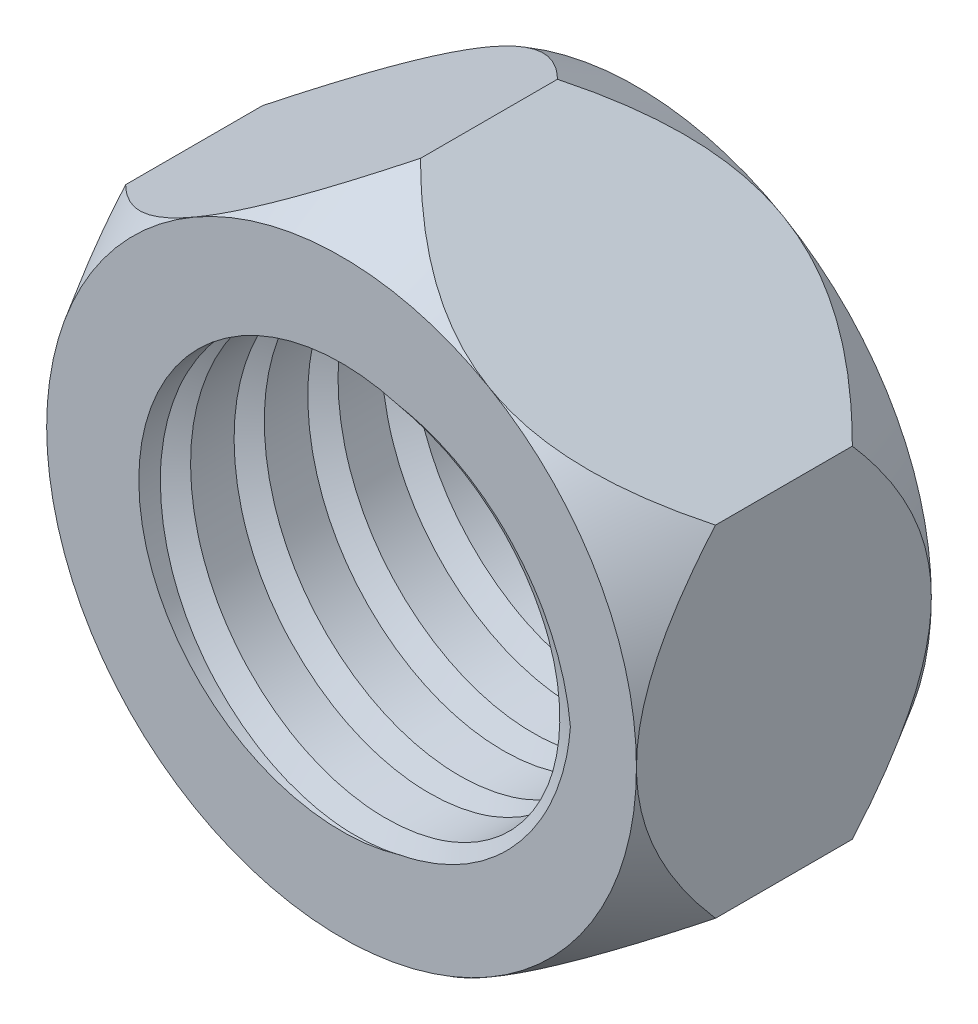
from build123d import *

# Parameters (mm, degrees)
Y_KSEKLIK_EKSTR_ZYON1_DEPTH = 4
IZIM2_OUTSIDE_W             = 17.19
IZIM2_OUTSIDE_H             = 18.428
IZIM2_OUTSIDE_R             = 4
KES_EKSTR_ZYON1_DEPTH       = 4
KES_EKSTR_ZYON1_DRAFT       = -30
IZIM3_OUTSIDE_W             = 17.19
IZIM3_OUTSIDE_H             = 18.428
IZIM3_OUTSIDE_R             = 4
KES_EKSTR_ZYON2_DEPTH       = 4
KES_EKSTR_ZYON2_DRAFT       = -30
KES_EKSTR_ZYON3_REACH       = 9.303
IZIM4_R                     = 2.75
KES_S_P_R2_PITCH            = 1


with BuildPart() as part:
    # Çizim1 → Yükseklik-Ekstrüzyon1 (new body)
    with BuildSketch(Plane.XY):
        Polygon((0, 4.618802154), (-4, 2.309401077), (-4, -2.309401077), (0, -4.618802154), (4, -2.309401077), (4, 2.309401077), align=None)
    extrude(amount=Y_KSEKLIK_EKSTR_ZYON1_DEPTH)


with BuildPart() as kes_ekstr_zyon1_tool:
    # Çizim2 outside → Kes-Ekstrüzyon1 (with draft: the straight prism first)
    with BuildSketch(Plane.XY.offset(4)):
        Rectangle(IZIM2_OUTSIDE_W, IZIM2_OUTSIDE_H)
        Circle(IZIM2_OUTSIDE_R, mode=Mode.SUBTRACT)
    extrude(amount=-KES_EKSTR_ZYON1_DEPTH)
    # Kes-Ekstrüzyon1: the draft: its side faces are tilted about the plane it starts from
    kes_ekstr_zyon1_sides = [kes_ekstr_zyon1_tool.faces().sort_by_distance(p)[0] for p in [
        (0, -9.214, 2),
        (8.595, 0, 2),
        (0, 9.214, 2),
        (-8.595, 0, 2),
        (-4, 0, 2),
    ]]
    draft(kes_ekstr_zyon1_sides, Plane.XY.offset(4), KES_EKSTR_ZYON1_DRAFT)


with BuildPart() as part_1:
    add(part.part)

    # Kes-Ekstrüzyon1: cut by kes_ekstr_zyon1_tool
    add(kes_ekstr_zyon1_tool.part, mode=Mode.SUBTRACT)


with BuildPart() as kes_ekstr_zyon2_tool:
    # Çizim3 outside → Kes-Ekstrüzyon2 (with draft: the straight prism first)
    with BuildSketch(Plane(origin=(0, 0, 0), x_dir=(-1, 0, 0), z_dir=(0, 0, -1))):
        Rectangle(IZIM3_OUTSIDE_W, IZIM3_OUTSIDE_H)
        Circle(IZIM3_OUTSIDE_R, mode=Mode.SUBTRACT)
    extrude(amount=-KES_EKSTR_ZYON2_DEPTH)
    # Kes-Ekstrüzyon2: the draft: its side faces are tilted about the plane it starts from
    kes_ekstr_zyon2_sides = [kes_ekstr_zyon2_tool.faces().sort_by_distance(p)[0] for p in [
        (0, -9.214, 2),
        (-8.595, 0, 2),
        (0, 9.214, 2),
        (8.595, 0, 2),
        (4, 0, 2),
    ]]
    draft(kes_ekstr_zyon2_sides, Plane(origin=(0, 0, 0), x_dir=(-1, 0, 0), z_dir=(0, 0, -1)), KES_EKSTR_ZYON2_DRAFT)


with BuildPart() as part_2:
    add(part_1.part)

    # Kes-Ekstrüzyon2: cut by kes_ekstr_zyon2_tool
    add(kes_ekstr_zyon2_tool.part, mode=Mode.SUBTRACT)

    # Çizim4 → Kes-Ekstrüzyon3 (cut, up to next)
    with BuildSketch(Plane.XY.offset(4), mode=Mode.PRIVATE) as kes_ekstr_zyon3_sk1:
        Circle(IZIM4_R)
    kes_ekstr_zyon3_tool1 = extrude(kes_ekstr_zyon3_sk1.sketch, amount=-KES_EKSTR_ZYON3_REACH, mode=Mode.PRIVATE) & part_2.part
    add(kes_ekstr_zyon3_tool1.solids().sort_by_distance((0, 0, 4))[0], mode=Mode.SUBTRACT)

    # Kes-Süpür2: arcs per turn and ends read off the stored shape
    # Kes-Süpür2: the profile of Çizim6 screwed along a right-hand helix through 5.5 turns, 8 arcs to a turn; built about Z, then put on its axis
    kes_s_p_r2_z = Axis((0, 0, 0), (0, 0, 1))
    kes_s_p_r2_corners = [(3.104276851, -7.6074e-05, -0.99868553), (2.354276851, 0.024942466, -1.430974869), (2.354276851, -0.025094614, -0.566396191)]
    with BuildLine(mode=Mode.PRIVATE) as kes_s_p_r2_profile:
        Line(kes_s_p_r2_corners[0], kes_s_p_r2_corners[1])
        Line(kes_s_p_r2_corners[1], kes_s_p_r2_corners[2])
        Line(kes_s_p_r2_corners[2], kes_s_p_r2_corners[0])
    kes_s_p_r2_cap = Face(kes_s_p_r2_profile.wire())
    kes_s_p_r2_turn_angles = [0, 22.5, 45, 67.5, 90, 112.5, 135, 157.5, 180, 202.5, 225, 247.5, 270, 292.5, 315, 337.5, 360]
    kes_s_p_r2_turn_weights = [1, 0.9238795325112867, 1, 0.9238795325112867, 1, 0.9238795325112867, 1, 0.9238795325112867, 1, 0.9238795325112867, 1, 0.9238795325112867, 1, 0.9238795325112867, 1, 0.9238795325112867, 1]
    kes_s_p_r2_turn_rails = [Edge.make_bspline([Vector(p[0], p[1], 0).rotate(kes_s_p_r2_z, kes_s_p_r2_turn_angles[k]) / kes_s_p_r2_turn_weights[k] + Vector(0, 0, p[2] + KES_S_P_R2_PITCH * kes_s_p_r2_turn_angles[k] / 360) for k in range(17)], [0, 0, 0, 1, 1, 2, 2, 3, 3, 4, 4, 5, 5, 6, 6, 7, 7, 8, 8, 8], 2, kes_s_p_r2_turn_weights) for p in kes_s_p_r2_corners]
    kes_s_p_r2_turn_sides = [Face.make_surface_from_curves(kes_s_p_r2_turn_rails[p[0]], kes_s_p_r2_turn_rails[p[1]]) for p in [(0, 1), (1, 2), (2, 0)]]
    kes_s_p_r2_last_angles = [1800, 1822.5, 1845, 1867.5, 1890, 1912.5, 1935, 1957.5, 1980]
    kes_s_p_r2_last_weights = [1, 0.9238795325112867, 1, 0.9238795325112867, 1, 0.9238795325112867, 1, 0.9238795325112867, 1]
    kes_s_p_r2_last_rails = [Edge.make_bspline([Vector(p[0], p[1], 0).rotate(kes_s_p_r2_z, kes_s_p_r2_last_angles[k]) / kes_s_p_r2_last_weights[k] + Vector(0, 0, p[2] + KES_S_P_R2_PITCH * kes_s_p_r2_last_angles[k] / 360) for k in range(9)], [0, 0, 0, 1, 1, 2, 2, 3, 3, 4, 4, 4], 2, kes_s_p_r2_last_weights) for p in kes_s_p_r2_corners]
    kes_s_p_r2_last_sides = [Face.make_surface_from_curves(kes_s_p_r2_last_rails[p[0]], kes_s_p_r2_last_rails[p[1]]) for p in [(0, 1), (1, 2), (2, 0)]]
    kes_s_p_r2 = Plane(origin=(0, 0, 4), x_dir=(1, 0, 0), z_dir=(0, 0, -1)) * Solid(Shell([*[p.moved(Location((0, 0, KES_S_P_R2_PITCH * i))) for i in range(5) for p in kes_s_p_r2_turn_sides], *kes_s_p_r2_last_sides, kes_s_p_r2_cap, kes_s_p_r2_cap.rotate(kes_s_p_r2_z, 1980).moved(Location((0, 0, KES_S_P_R2_PITCH * 1980 / 360)))]))
    add(kes_s_p_r2, mode=Mode.SUBTRACT)


solid = part_2.part
